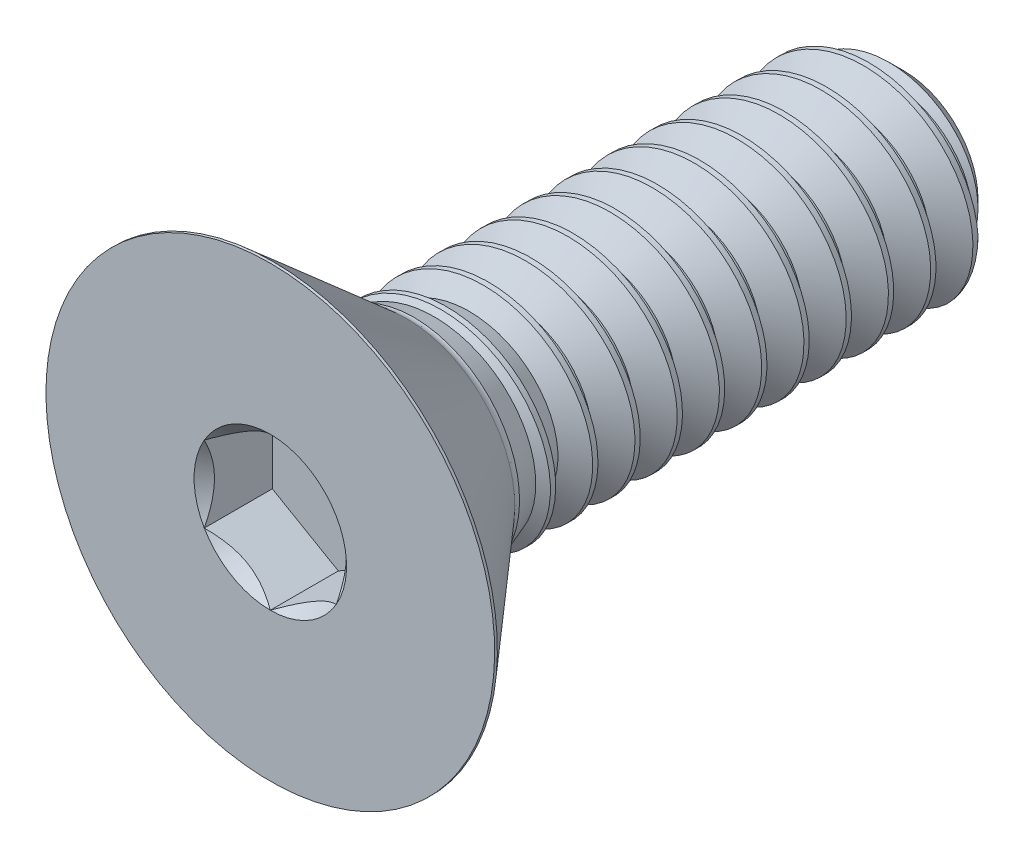
from build123d import *

# Parameters (mm, degrees)
SKETCH10_R         = 2.291358881
CUT_EXTRUDE2_DEPTH = 2.0447
CUT_EXTRUDE2_DRAFT = -45
CUT_EXTRUDE1_DEPTH = 2.0447
CUT_SWEEP1_PITCH   = 1.27
CUT_SWEEP1_TO      = 14.733428


with BuildPart() as part:
    # Sketch2 → Revolve1 (revolve)
    with BuildSketch(Plane(origin=(0, 0, 0), x_dir=(0, 0, -1), z_dir=(1, 0, 0))):
        with BuildLine():
            Line((-9.443212, 6.7437), (-5.4356, 3.259936038))
            ThreePointArc((-5.4356, 3.259936038), (-5.329693592, 3.196928347), (-5.208428247, 3.175))
            Line((-5.208428247, 3.175), (8.5725, 3.175))
            Line((8.5725, 3.175), (9.525, 2.2225))
            Line((9.525, 2.2225), (9.525, 0))
            Line((9.525, 0), (-9.525, 0))
            Line((-9.525, 0), (-9.525, 6.7437))
            Line((-9.525, 6.7437), (-9.443212, 6.7437))
        make_face()
    revolve(axis=Axis((0, 0, -9.525), (0, 0, 1)))


with BuildPart() as cut_extrude2_tool:
    # Sketch10 → Cut-Extrude2 (with draft: the straight prism first)
    with BuildSketch(Plane.XY.offset(9.525)):
        Circle(SKETCH10_R)
    extrude(amount=-CUT_EXTRUDE2_DEPTH)
    # Cut-Extrude2: the draft: its side faces are tilted about the plane it starts from
    cut_extrude2_sides = [cut_extrude2_tool.faces().sort_by_distance(p)[0] for p in [
        (-2.291358881, 0, 8.50265),
    ]]
    draft(cut_extrude2_sides, Plane.XY.offset(9.525), CUT_EXTRUDE2_DRAFT)


with BuildPart() as part_1:
    add(part.part)

    # Cut-Extrude2: cut by cut_extrude2_tool
    add(cut_extrude2_tool.part, mode=Mode.SUBTRACT)

    # Sketch9 → Cut-Extrude1 (cut)
    with BuildSketch(Plane.XY.offset(9.525)):
        Polygon((1.984375, -1.14567944), (1.984375, 1.14567944), (0, 2.291358881), (-1.984375, 1.14567944), (-1.984375, -1.14567944), (0, -2.291358881), align=None)
    extrude(amount=-CUT_EXTRUDE1_DEPTH, mode=Mode.SUBTRACT)


with BuildPart() as body_2:
    # Split1: the piece on the far side of the plane
    add(part_1.part)
    split(bisect_by=Plane.XY.offset(5.208428247), keep=Keep.BOTTOM)

    # Cut-Sweep1: arcs per turn and ends read off the stored shape
    # Cut-Sweep1: the profile of Sketch4 screwed along a right-hand helix through 15 turns, 8 arcs to a turn; built about Z, then put on its axis
    cut_sweep1_z = Axis((0, 0, 0), (0, 0, 1))
    cut_sweep1_corners = [(3.243740766, 0, 0.0396875), (3.243740766, 0, -1.1509375), (2.350110803, 0, -0.635), (2.350110803, 0, -0.47625)]
    with BuildLine(mode=Mode.PRIVATE) as cut_sweep1_profile:
        Line(cut_sweep1_corners[0], cut_sweep1_corners[1])
        Line(cut_sweep1_corners[1], cut_sweep1_corners[2])
        Line(cut_sweep1_corners[2], cut_sweep1_corners[3])
        Line(cut_sweep1_corners[3], cut_sweep1_corners[0])
    cut_sweep1_cap = Face(cut_sweep1_profile.wire())
    cut_sweep1_turn_angles = [0, 22.5, 45, 67.5, 90, 112.5, 135, 157.5, 180, 202.5, 225, 247.5, 270, 292.5, 315, 337.5, 360]
    cut_sweep1_turn_weights = [1, 0.9238795325112867, 1, 0.9238795325112867, 1, 0.9238795325112867, 1, 0.9238795325112867, 1, 0.9238795325112867, 1, 0.9238795325112867, 1, 0.9238795325112867, 1, 0.9238795325112867, 1]
    cut_sweep1_turn_rails = [Edge.make_bspline([Vector(p[0], p[1], 0).rotate(cut_sweep1_z, cut_sweep1_turn_angles[k]) / cut_sweep1_turn_weights[k] + Vector(0, 0, p[2] + CUT_SWEEP1_PITCH * cut_sweep1_turn_angles[k] / 360) for k in range(17)], [0, 0, 0, 1, 1, 2, 2, 3, 3, 4, 4, 5, 5, 6, 6, 7, 7, 8, 8, 8], 2, cut_sweep1_turn_weights) for p in cut_sweep1_corners]
    cut_sweep1_turn_sides = [Face.make_surface_from_curves(cut_sweep1_turn_rails[p[0]], cut_sweep1_turn_rails[p[1]]) for p in [(0, 1), (1, 2), (2, 3), (3, 0)]]
    cut_sweep1 = Plane(origin=(0, 0, -9.525), x_dir=(0, 1, 0), z_dir=(0, 0, 1)) * split(Solid(Shell([*[p.moved(Location((0, 0, CUT_SWEEP1_PITCH * i))) for i in range(15) for p in cut_sweep1_turn_sides], cut_sweep1_cap, cut_sweep1_cap.rotate(cut_sweep1_z, 5400).moved(Location((0, 0, CUT_SWEEP1_PITCH * 5400 / 360)))])), bisect_by=Plane.XY.offset(CUT_SWEEP1_TO), keep=Keep.BOTTOM, mode=Mode.PRIVATE)
    add(cut_sweep1, mode=Mode.SUBTRACT)


with BuildPart() as part_2:
    add(part_1.part)

    # Split1
    split(bisect_by=Plane.XY.offset(5.208428247), keep=Keep.TOP)

    add(body_2.part)  # Boss-Extrude2 merges body 2
    # Boss-Extrude2 cone 1 section (through the dimple's axis) → Boss-Extrude2 (revolve)
    with BuildSketch(Plane(origin=(0, 0, 5.208428247), x_dir=(0, -1, 0), z_dir=(1, 0, 0))):
        Polygon((0, 0), (3.175, 0), (0, 8.723240807), align=None)
    revolve(axis=Axis((0, 0, 5.208428247), (0, 0, -1)))


solid = part_2.part
